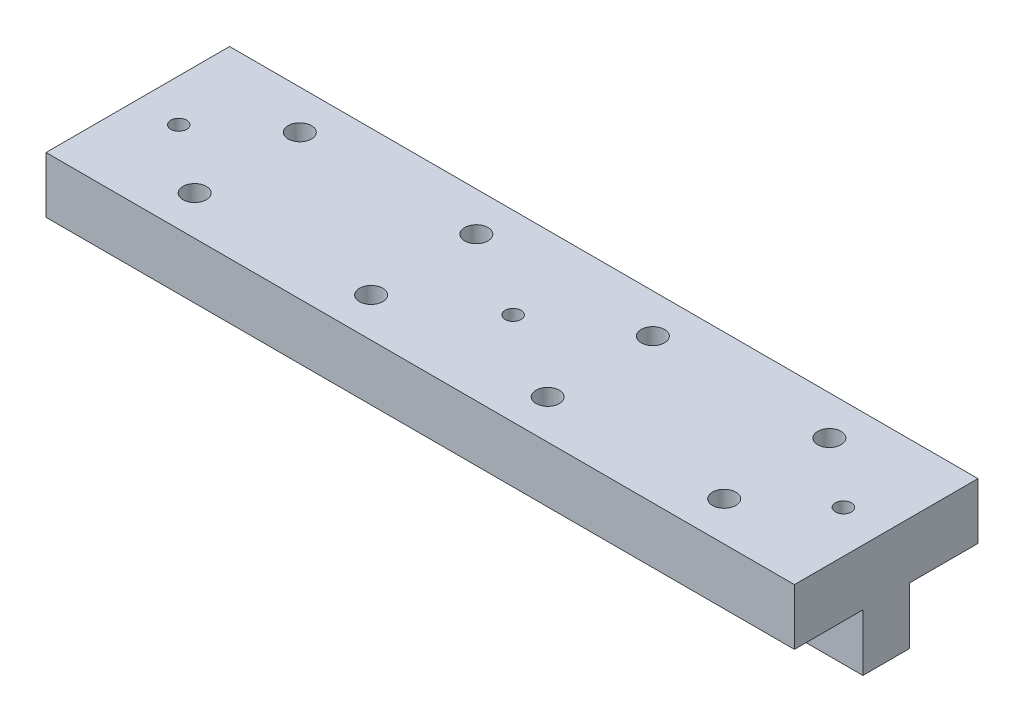
from build123d import *

# Parameters (mm, degrees)
SKETCH4_W                       = 106
SKETCH4_H                       = 16
BOSS_EXTRUDE2_DEPTH             = 13
CUT_EXTRUDE3_START              = -9.7
SKETCH25_W                      = 106
SKETCH25_H                      = 8.1
CUT_EXTRUDE3_DEPTH              = 107.216438698
M4X0_7_TAPPED_HOLE1_D           = 3.3
MIRROR1_START                   = -24.601316976
MIRROR1_OUTLINE_W               = 106
MIRROR1_OUTLINE_H               = 13
MIRROR1_OUTLINE_R               = 1.65
MIRROR1_DEPTH                   = 7.951316976
MIRROR1_START_2                 = -32.65
MIRROR1_2_OUTLINE_W             = 106
MIRROR1_2_OUTLINE_H             = 3.3
MIRROR1_2_DEPTH                 = 8.048683024
F_4_40_TAPPED_HOLE1_D           = 2.2606
F_4_40_TAPPED_HOLE1_ON_FACE_2_D = 2.2606


# Read off the part's stored shape, not the designer's step: Mirror1
with BuildPart() as part:
    # Sketch4 → Boss-Extrude2 (new body)
    with BuildSketch(Plane.XY):
        with Locations((-36.891047602, -24.65)):
            Rectangle(SKETCH4_W, SKETCH4_H)
    extrude(amount=-BOSS_EXTRUDE2_DEPTH)

    # Sketch25 → Cut-Extrude3 (cut)
    with BuildSketch(Plane.XY.offset(CUT_EXTRUDE3_START)):
        with Locations((-36.891047602, -28.651316976)):
            Rectangle(SKETCH25_W, SKETCH25_H)
    extrude(amount=CUT_EXTRUDE3_DEPTH, mode=Mode.SUBTRACT)

    # M4x0.7 Tapped Hole1 (through all)
    with Locations(Plane(origin=(-74.391047602, -16.65, -5.55), x_dir=(0, 0, 1), z_dir=(0, 1, 0))):
        with Locations((0, 0), (0, 25), (0, 75), (0, 50)):
            Hole(M4X0_7_TAPPED_HOLE1_D / 2)

    # Mirror1 outline → Mirror1 (add)
    with BuildSketch(Plane(origin=(0, 0, 0), x_dir=(1, 0, 0), z_dir=(0, 1, 0)).offset(MIRROR1_START)):
        with Locations((-36.891047602, 19.5)):
            Rectangle(MIRROR1_OUTLINE_W, MIRROR1_OUTLINE_H)
        with Locations((-74.391047602, 20.45)):
            Circle(MIRROR1_OUTLINE_R, mode=Mode.SUBTRACT)
        with Locations((-49.391047602, 20.45)):
            Circle(MIRROR1_OUTLINE_R, mode=Mode.SUBTRACT)
        with Locations((-24.391047602, 20.45)):
            Circle(MIRROR1_OUTLINE_R, mode=Mode.SUBTRACT)
        with Locations((0.608952398, 20.45)):
            Circle(MIRROR1_OUTLINE_R, mode=Mode.SUBTRACT)
    extrude(amount=MIRROR1_DEPTH)

    # Mirror1 2 outline → Mirror1 2 (add)
    with BuildSketch(Plane(origin=(0, 0, 0), x_dir=(1, 0, 0), z_dir=(0, 1, 0)).offset(MIRROR1_START_2)):
        with Locations((-36.891047602, 14.65)):
            Rectangle(MIRROR1_2_OUTLINE_W, MIRROR1_2_OUTLINE_H)
    extrude(amount=MIRROR1_2_DEPTH)

    # #4-40 Tapped Hole1 (through all)
    with Locations(Plane(origin=(-83.891047602, -32.65, -12.801414568), x_dir=(0, 0, -1), z_dir=(0, -1, 0))):
        with Locations((0, 0), (0.13677014, 94), (0.355392609, 47)):
            Hole(F_4_40_TAPPED_HOLE1_D / 2)

    # #4-40 Tapped Hole1 on face 2 (through all)
    with Locations(Plane(origin=(-13.707536503, 0, 46.33240541), x_dir=(0, 0, -1), z_dir=(0, -1, 0))):
        with Locations((0, 0)):
            Hole(F_4_40_TAPPED_HOLE1_ON_FACE_2_D / 2)


solid = part.part
